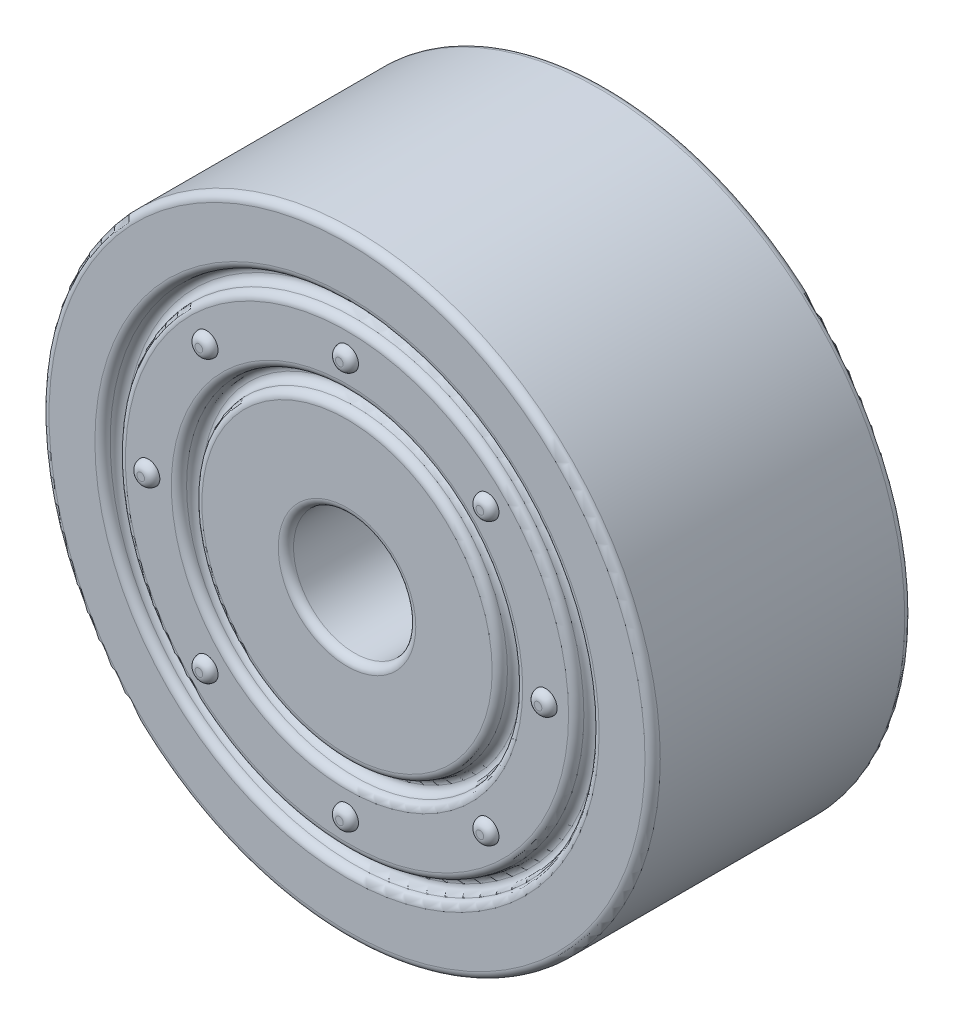
from build123d import *

# Parameters (mm, degrees)
SKETCH1_R           = 20
SKETCH1_R_2         = 4
BOSS_EXTRUDE2_DEPTH = 17
SKETCH3_R           = 16
SKETCH3_R_2         = 15
CUT_EXTRUDE1_DEPTH  = 1
FILLET9_R           = 0.5
FILLET10_R          = 0.5
SKETCH4_R           = 11
SKETCH4_R_2         = 10
CUT_EXTRUDE2_DEPTH  = 1
FILLET11_R          = 0.5
FILLET12_R          = 0.5
SKETCH6_R           = 0.75
BOSS_EXTRUDE5_DEPTH = 0.5
FILLET17_R          = 0.5
FILLET18_R          = 0.5
FILLET19_R          = 0.5
FILLET20_R          = 0.5


with BuildPart() as part:
    # Sketch1 → Boss-Extrude2 (new body)
    with BuildSketch(Plane.XY):
        Circle(SKETCH1_R)
        Circle(SKETCH1_R_2, mode=Mode.SUBTRACT)
    extrude(amount=BOSS_EXTRUDE2_DEPTH)

    # Sketch3 → Cut-Extrude1 (cut)
    with BuildSketch(Plane.XY.offset(17)):
        Circle(SKETCH3_R)
        Circle(SKETCH3_R_2, mode=Mode.SUBTRACT)
    extrude(amount=-CUT_EXTRUDE1_DEPTH, mode=Mode.SUBTRACT)

    # Fillet9
    fillet9_edges = [part.edges().sort_by_distance(p)[0] for p in [
        (-16, 0, 16),
        (-15, 0, 16),
    ]]
    fillet(fillet9_edges, radius=FILLET9_R - 0.0001)  # a hair under: the kernel refuses the full size

    # Fillet10
    fillet10_edges = [part.edges().sort_by_distance(p)[0] for p in [
        (-16, 0, 17),
        (-15, 0, 17),
    ]]
    fillet(fillet10_edges, radius=FILLET10_R)

    # Sketch4 → Cut-Extrude2 (cut)
    with BuildSketch(Plane.XY.offset(17)):
        Circle(SKETCH4_R)
        Circle(SKETCH4_R_2, mode=Mode.SUBTRACT)
    extrude(amount=-CUT_EXTRUDE2_DEPTH, mode=Mode.SUBTRACT)

    # Fillet11
    fillet11_edges = [part.edges().sort_by_distance(p)[0] for p in [
        (-11, 0, 16),
        (-10, 0, 16),
    ]]
    fillet(fillet11_edges, radius=FILLET11_R - 0.0001)  # a hair under: the kernel refuses the full size
    fillet11_2_edges = [part.edges().sort_by_distance(p)[0] for p in [
        (-11, 0, 17),
        (-10, 0, 17),
    ]]
    fillet(fillet11_2_edges, radius=FILLET11_R)

    # Fillet12
    fillet12_edges = [part.edges().sort_by_distance(p)[0] for p in [
        (-20, 0, 0),
        (-20, 0, 17),
    ]]
    fillet(fillet12_edges, radius=FILLET12_R)

    # Sketch6 → Boss-Extrude5 (add)
    with BuildSketch(Plane.XY.offset(17)):
        with Locations((0, 13)):
            Circle(SKETCH6_R)
        with Locations((9.192388155, 9.192388155)):
            Circle(SKETCH6_R)
        with Locations((13, 0)):
            Circle(SKETCH6_R)
        with Locations((9.192388155, -9.192388155)):
            Circle(SKETCH6_R)
        with Locations((0, -13)):
            Circle(SKETCH6_R)
        with Locations((-9.192388155, -9.192388155)):
            Circle(SKETCH6_R)
        with Locations((-13, 0)):
            Circle(SKETCH6_R)
        with Locations((-9.192388155, 9.192388155)):
            Circle(SKETCH6_R)
    extrude(amount=BOSS_EXTRUDE5_DEPTH)

    # Fillet17
    fillet17_edges = [part.edges().sort_by_distance(p)[0] for p in [
        (-4, 0, 0),
        (-4, 0, 17),
    ]]
    fillet(fillet17_edges, radius=FILLET17_R)

    # Fillet18
    fillet18_edges = [part.edges().sort_by_distance(p)[0] for p in [
        (8.442388155, -9.192388155, 17.5),
    ]]
    fillet(fillet18_edges, radius=FILLET18_R - 0.0001)  # a hair under: the kernel refuses the full size

    # Fillet19
    fillet19_edges = [part.edges().sort_by_distance(p)[0] for p in [
        (-0.75, -13, 17.5),
    ]]
    fillet(fillet19_edges, radius=FILLET19_R - 0.0001)  # a hair under: the kernel refuses the full size

    # Fillet20
    fillet20_edges = [part.edges().sort_by_distance(p)[0] for p in [
        (-0.75, 13, 17.5),
        (8.442388155, 9.192388155, 17.5),
        (12.25, 0, 17.5),
        (-9.942388155, -9.192388155, 17.5),
        (-13.75, 0, 17.5),
        (-9.942388155, 9.192388155, 17.5),
    ]]
    fillet(fillet20_edges, radius=FILLET20_R - 0.0001)  # a hair under: the kernel refuses the full size


solid = part.part
